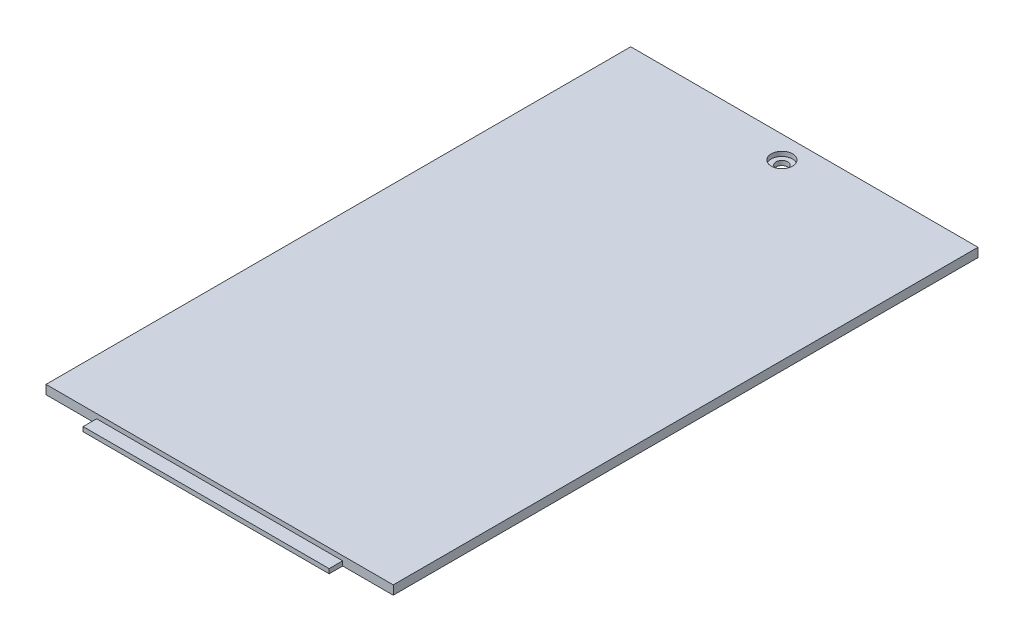
from build123d import *

# Parameters (mm, degrees)
SKETCH_1_W          = 77.2
SKETCH_1_H          = 130
EXTRUDE_1_DEPTH     = 2
SKETCH_3_R          = 1.3
CUT_EXTRUDE_1_DEPTH = 76.623805776
SKETCH_5_R          = 2.375
CUT_EXTRUDE_2_DEPTH = 1
SKETCH_6_W          = 54.7
SKETCH_6_H          = 1
EXTRUDE_2_DEPTH     = 3


with BuildPart() as part:
    # Эскиз1 → Бобышка-Вытянуть1 (new body)
    with BuildSketch(Plane(origin=(0, 0, 0), x_dir=(1, 0, 0), z_dir=(0, 1, 0))):
        Rectangle(SKETCH_1_W, SKETCH_1_H)
    extrude(amount=EXTRUDE_1_DEPTH)

    # Эскиз3 → Вырез-Вытянуть1 (cut, through all)
    with BuildSketch(Plane(origin=(0, 2, 0), x_dir=(1, 0, 0), z_dir=(0, 1, 0))):
        with Locations((0, 60)):
            Circle(SKETCH_3_R)
    extrude(amount=-CUT_EXTRUDE_1_DEPTH, mode=Mode.SUBTRACT)

    # Эскиз5 → Вырез-Вытянуть2 (cut)
    with BuildSketch(Plane(origin=(0, 2, 0), x_dir=(1, 0, 0), z_dir=(0, 1, 0))):
        with Locations((0, 60)):
            Circle(SKETCH_5_R)
    extrude(amount=-CUT_EXTRUDE_2_DEPTH, mode=Mode.SUBTRACT)

    # Эскиз6 → Бобышка-Вытянуть2 (add)
    with BuildSketch(Plane.XY.offset(65)):
        with Locations((0, 0.5)):
            Rectangle(SKETCH_6_W, SKETCH_6_H)
    extrude(amount=EXTRUDE_2_DEPTH)


solid = part.part
